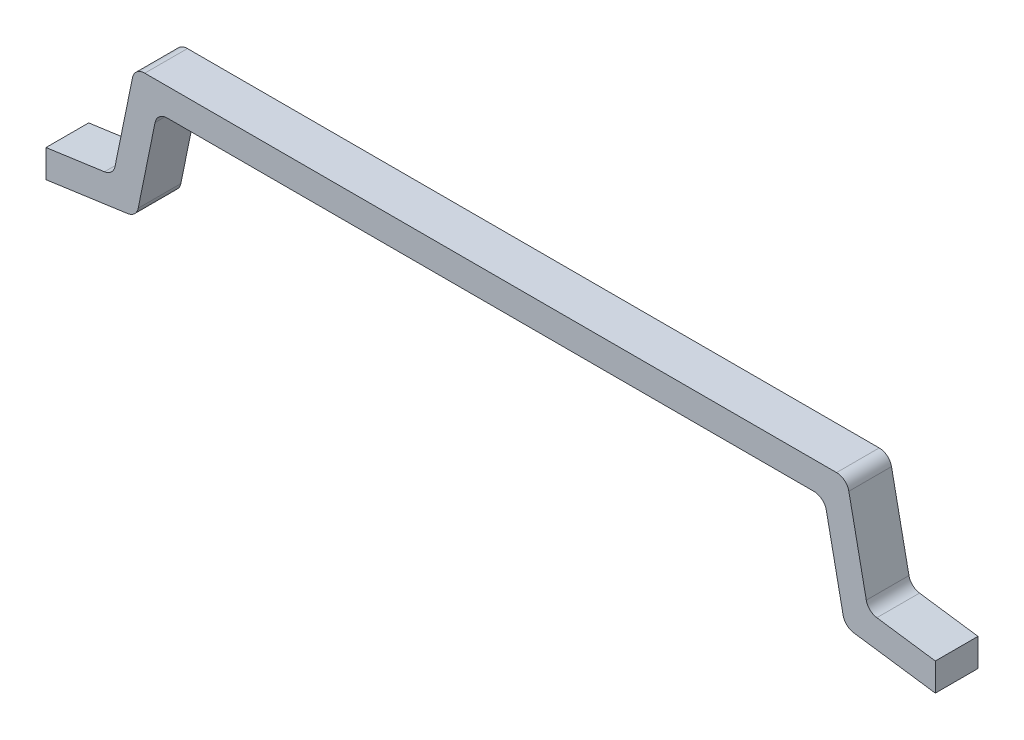
from build123d import *

# Parameters (mm, degrees)
BOSS_EXTRUDE1_DEPTH  = 0.51
FILLET2_R            = 0.15
SKETCH3_W            = 0.51
SKETCH3_H            = 0.33
BOSS_EXTRUDE2_DEPTH  = 3.8
FILLET2_OF_MIRROR2_R = 0.15


with BuildPart() as part:
    # Sketch2 → Boss-Extrude1 (new body)
    with BuildSketch(Plane.XY):
        Polygon((0, 0.280138432), (0, 0), (0, -0.053104667), (1.080748407, 0.098784616), (1.148133843, 0.429247456), (1.327730115, 1.31), (1.515, 1.31), (1.515, 1.64), (1.058230308, 1.64), (0.803978227, 0.393130203), align=None)
    boss_extrude1 = extrude(amount=BOSS_EXTRUDE1_DEPTH)

    # Fillet2
    fillet2_edges = [part.edges().sort_by_distance(p)[0] for p in [
        (1.058230308, 1.64, 0.255),
        (1.327730115, 1.31, 0.255),
        (1.080748407, 0.098784616, 0.255),
        (0.803978227, 0.393130203, 0.255),
    ]]
    fillet(fillet2_edges, radius=FILLET2_R)

    # Sketch3 → Boss-Extrude2 (add)
    with BuildSketch(Plane(origin=(1.515, 0, 0), x_dir=(0, 0, -1), z_dir=(1, 0, 0))):
        with Locations((-0.255, 1.475)):
            Rectangle(SKETCH3_W, SKETCH3_H)
    boss_extrude2 = extrude(amount=BOSS_EXTRUDE2_DEPTH)

    # Mirror2: Boss-Extrude1, Boss-Extrude2 across plane
    add(boss_extrude1.mirror(Plane(origin=(5.315, 0, 0), x_dir=(0, 0, 1), z_dir=(1, 0, 0))))
    add(boss_extrude2.mirror(Plane(origin=(5.315, 0, 0), x_dir=(0, 0, 1), z_dir=(1, 0, 0))))

    # Fillet2 of Mirror2
    fillet2_of_mirror2_edges = [part.edges().sort_by_distance(p)[0] for p in [
        (9.571769692, 1.64, 0.255),
        (9.302269885, 1.31, 0.255),
        (9.549251593, 0.098784616, 0.255),
        (9.826021773, 0.393130203, 0.255),
    ]]
    fillet(fillet2_of_mirror2_edges, radius=FILLET2_OF_MIRROR2_R)


solid = part.part
